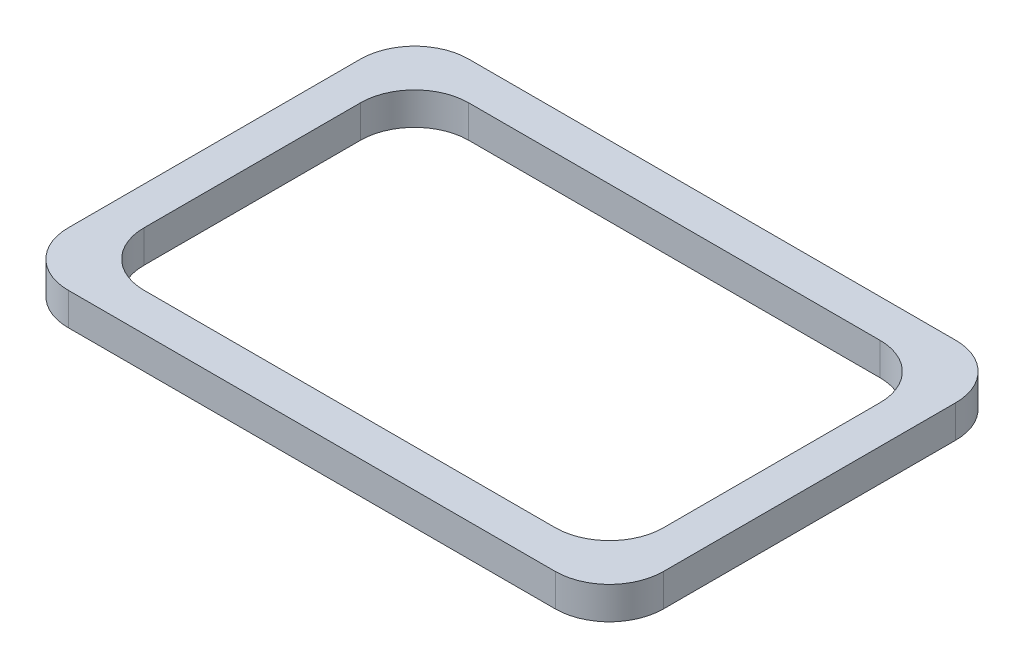
from build123d import *

# Parameters (mm, degrees)
BOSS_EXTRUDE1_DEPTH = 3


with BuildPart() as part:
    # Sketch1 → Boss-Extrude1 (new body)
    with BuildSketch(Plane(origin=(0, 0, 0), x_dir=(1, 0, 0), z_dir=(0, 1, 0))):
        with BuildLine():
            Line((-22.5, 18.5), (22.5, 18.5))
            ThreePointArc((22.5, 18.5), (26.035533906, 17.035533906), (27.5, 13.5))
            Line((27.5, 13.5), (27.5, -13.5))
            ThreePointArc((27.5, -13.5), (26.035533906, -17.035533906), (22.5, -18.5))
            Line((22.5, -18.5), (-22.5, -18.5))
            ThreePointArc((-22.5, -18.5), (-26.035533906, -17.035533906), (-27.5, -13.5))
            Line((-27.5, -13.5), (-27.5, 13.5))
            ThreePointArc((-27.5, 13.5), (-26.035533906, 17.035533906), (-22.5, 18.5))
        make_face()
        with BuildLine():
            Line((-19, -15), (19, -15))
            ThreePointArc((19, -15), (22.535533906, -13.535533906), (24, -10))
            Line((24, -10), (24, 10))
            ThreePointArc((24, 10), (22.535533906, 13.535533906), (19, 15))
            Line((19, 15), (-19, 15))
            ThreePointArc((-19, 15), (-22.535533906, 13.535533906), (-24, 10))
            Line((-24, 10), (-24, -10))
            ThreePointArc((-24, -10), (-22.535533906, -13.535533906), (-19, -15))
        make_face(mode=Mode.SUBTRACT)
    extrude(amount=BOSS_EXTRUDE1_DEPTH)


solid = part.part
